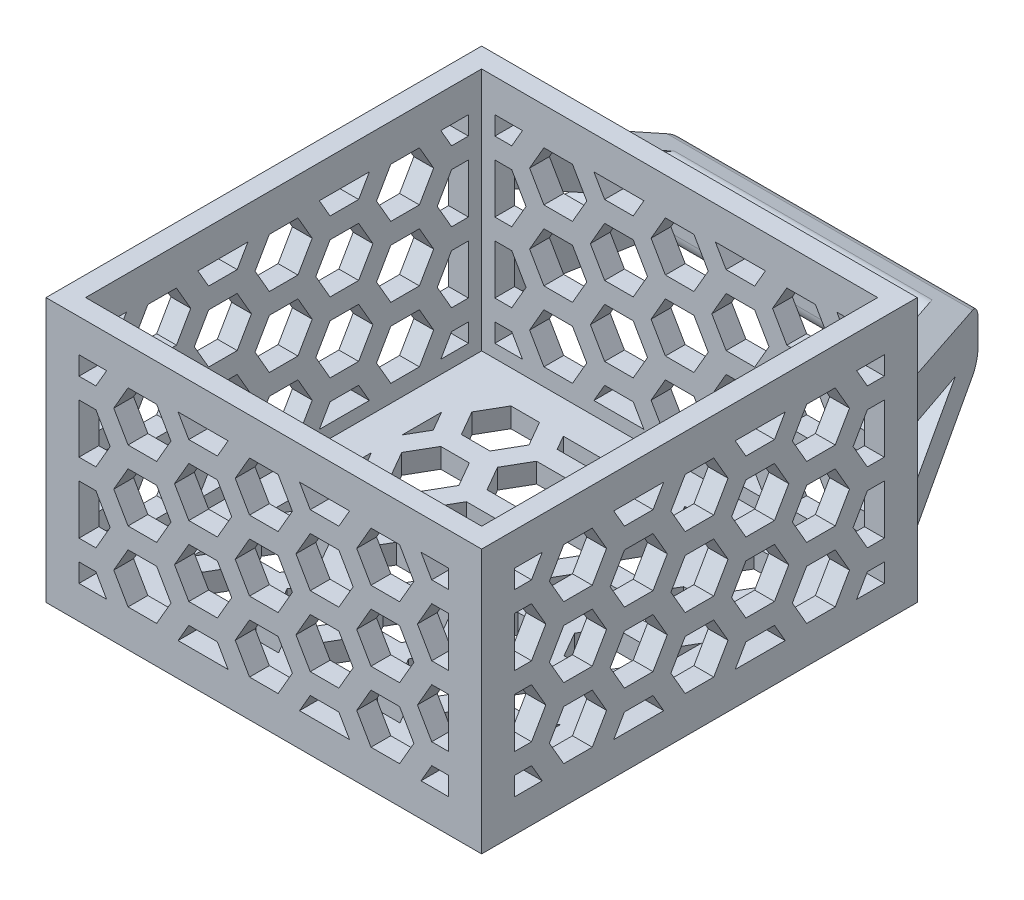
from build123d import *

# Parameters (mm, degrees)
SKETCH1_W               = 120
SKETCH1_H               = 120
BOSS_EXTRUDE2_DEPTH     = 6
SKETCH2_W               = 132
SKETCH2_H               = 80
BOSS_EXTRUDE3_DEPTH     = 6
SKETCH3_W               = 120
SKETCH3_H               = 80
BOSS_EXTRUDE4_DEPTH     = 6
BOSS_EXTRUDE5_START     = -40
BOSS_EXTRUDE5_DEPTH     = 20
CUT_EXTRUDE2_DEPTH      = 149.296999295
CUT_EXTRUDE2_DEPTH_BACK = 149.296999295
FILLET2_R               = 5
FILLET3_R               = 5
FILLET4_R               = 5
FILLET5_R               = 5


with BuildPart() as part:
    # Sketch1 → Boss-Extrude2 (new body)
    with BuildSketch(Plane(origin=(0, 0, 0), x_dir=(1, 0, 0), z_dir=(0, 1, 0))):
        Rectangle(SKETCH1_W, SKETCH1_H)
        Polygon((8.660254038, 21.25), (4.330127019, 28.75), (-4.330127019, 28.75), (-8.660254038, 21.25), (-4.330127019, 13.75), (4.330127019, 13.75), align=None, mode=Mode.SUBTRACT)
        Polygon((8.660254038, 0), (4.330127019, 7.5), (-4.330127019, 7.5), (-8.660254038, 0), (-4.330127019, -7.5), (4.330127019, -7.5), align=None, mode=Mode.SUBTRACT)
        Polygon((8.660254038, 42.5), (4.330127019, 50), (-4.330127019, 50), (-8.660254038, 42.5), (-4.330127019, 35), (4.330127019, 35), align=None, mode=Mode.SUBTRACT)
        Polygon((8.660254038, -21.25), (4.330127019, -13.75), (-4.330127019, -13.75), (-8.660254038, -21.25), (-4.330127019, -28.75), (4.330127019, -28.75), align=None, mode=Mode.SUBTRACT)
        Polygon((8.660254038, -42.5), (4.330127019, -35), (-4.330127019, -35), (-8.660254038, -42.5), (-4.330127019, -50), (4.330127019, -50), align=None, mode=Mode.SUBTRACT)
        Polygon((27.063293868, 31.875), (22.733166849, 39.375), (14.072912811, 39.375), (9.742785793, 31.875), (14.072912811, 24.375), (22.733166849, 24.375), align=None, mode=Mode.SUBTRACT)
        Polygon((27.063293868, 10.625), (22.733166849, 18.125), (14.072912811, 18.125), (9.742785793, 10.625), (14.072912811, 3.125), (22.733166849, 3.125), align=None, mode=Mode.SUBTRACT)
        Polygon((11.547005384, 50), (14.072912811, 45.625), (22.733166849, 45.625), (25.259074277, 50), align=None, mode=Mode.SUBTRACT)
        Polygon((11.547005384, -50), (14.072912811, -45.625), (22.733166849, -45.625), (25.259074277, -50), align=None, mode=Mode.SUBTRACT)
        Polygon((22.733166849, -24.375), (27.063293868, -31.875), (22.733166849, -39.375), (14.072912811, -39.375), (9.742785793, -31.875), (14.072912811, -24.375), align=None, mode=Mode.SUBTRACT)
        Polygon((22.733166849, -3.125), (27.063293868, -10.625), (22.733166849, -18.125), (14.072912811, -18.125), (9.742785793, -10.625), (14.072912811, -3.125), align=None, mode=Mode.SUBTRACT)
        Polygon((45.466333699, 42.5), (41.13620668, 50), (32.475952642, 50), (28.145825623, 42.5), (32.475952642, 35), (41.13620668, 35), align=None, mode=Mode.SUBTRACT)
        Polygon((45.466333699, 21.25), (41.13620668, 28.75), (32.475952642, 28.75), (28.145825623, 21.25), (32.475952642, 13.75), (41.13620668, 13.75), align=None, mode=Mode.SUBTRACT)
        Polygon((45.466333699, 0), (41.13620668, 7.5), (32.475952642, 7.5), (28.145825623, 0), (32.475952642, -7.5), (41.13620668, -7.5), align=None, mode=Mode.SUBTRACT)
        Polygon((45.466333699, -21.25), (41.13620668, -13.75), (32.475952642, -13.75), (28.145825623, -21.25), (32.475952642, -28.75), (41.13620668, -28.75), align=None, mode=Mode.SUBTRACT)
        Polygon((45.466333699, -42.5), (41.13620668, -35), (32.475952642, -35), (28.145825623, -42.5), (32.475952642, -50), (41.13620668, -50), align=None, mode=Mode.SUBTRACT)
        Polygon((50, 37.852540378), (46.548865453, 31.875), (50, 25.897459622), align=None, mode=Mode.SUBTRACT)
        Polygon((50, 16.602540378), (46.548865453, 10.625), (50, 4.647459622), align=None, mode=Mode.SUBTRACT)
        Polygon((50, -16.602540378), (46.548865453, -10.625), (50, -4.647459622), align=None, mode=Mode.SUBTRACT)
        Polygon((50, -37.852540378), (46.548865453, -31.875), (50, -25.897459622), align=None, mode=Mode.SUBTRACT)
        Polygon((-46.548865453, -31.875), (-50, -25.897459622), (-50, -37.852540378), align=None, mode=Mode.SUBTRACT)
        Polygon((-46.548865453, -10.625), (-50, -4.647459622), (-50, -16.602540378), align=None, mode=Mode.SUBTRACT)
        Polygon((-50, 16.602540378), (-46.548865453, 10.625), (-50, 4.647459622), align=None, mode=Mode.SUBTRACT)
        Polygon((-50, 37.852540378), (-46.548865453, 31.875), (-50, 25.897459622), align=None, mode=Mode.SUBTRACT)
        Polygon((-41.13620668, 35), (-45.466333699, 42.5), (-41.13620668, 50), (-32.475952642, 50), (-28.145825623, 42.5), (-32.475952642, 35), align=None, mode=Mode.SUBTRACT)
        Polygon((-41.13620668, 13.75), (-45.466333699, 21.25), (-41.13620668, 28.75), (-32.475952642, 28.75), (-28.145825623, 21.25), (-32.475952642, 13.75), align=None, mode=Mode.SUBTRACT)
        Polygon((-41.13620668, -7.5), (-45.466333699, 0), (-41.13620668, 7.5), (-32.475952642, 7.5), (-28.145825623, 0), (-32.475952642, -7.5), align=None, mode=Mode.SUBTRACT)
        Polygon((-41.13620668, -28.75), (-45.466333699, -21.25), (-41.13620668, -13.75), (-32.475952642, -13.75), (-28.145825623, -21.25), (-32.475952642, -28.75), align=None, mode=Mode.SUBTRACT)
        Polygon((-41.13620668, -50), (-45.466333699, -42.5), (-41.13620668, -35), (-32.475952642, -35), (-28.145825623, -42.5), (-32.475952642, -50), align=None, mode=Mode.SUBTRACT)
        Polygon((-11.547005384, -50), (-25.259074277, -50), (-22.733166849, -45.625), (-14.072912811, -45.625), align=None, mode=Mode.SUBTRACT)
        Polygon((-14.072912811, -24.375), (-22.733166849, -24.375), (-27.063293868, -31.875), (-22.733166849, -39.375), (-14.072912811, -39.375), (-9.742785793, -31.875), align=None, mode=Mode.SUBTRACT)
        Polygon((-14.072912811, -3.125), (-22.733166849, -3.125), (-27.063293868, -10.625), (-22.733166849, -18.125), (-14.072912811, -18.125), (-9.742785793, -10.625), align=None, mode=Mode.SUBTRACT)
        Polygon((-22.733166849, 3.125), (-27.063293868, 10.625), (-22.733166849, 18.125), (-14.072912811, 18.125), (-9.742785793, 10.625), (-14.072912811, 3.125), align=None, mode=Mode.SUBTRACT)
        Polygon((-11.547005384, 50), (-14.072912811, 45.625), (-22.733166849, 45.625), (-25.259074277, 50), align=None, mode=Mode.SUBTRACT)
        Polygon((-22.733166849, 24.375), (-27.063293868, 31.875), (-22.733166849, 39.375), (-14.072912811, 39.375), (-9.742785793, 31.875), (-14.072912811, 24.375), align=None, mode=Mode.SUBTRACT)
    extrude(amount=BOSS_EXTRUDE2_DEPTH)

    # Sketch2 → Boss-Extrude3 (add)
    with BuildSketch(Plane.XY.offset(60)):
        with Locations((0, 40)):
            Rectangle(SKETCH2_W, SKETCH2_H)
        Polygon((8.660254038, 61.25), (4.330127019, 68.75), (-4.330127019, 68.75), (-8.660254038, 61.25), (-4.330127019, 53.75), (4.330127019, 53.75), align=None, mode=Mode.SUBTRACT)
        Polygon((8.660254038, 40), (4.330127019, 47.5), (-4.330127019, 47.5), (-8.660254038, 40), (-4.330127019, 32.5), (4.330127019, 32.5), align=None, mode=Mode.SUBTRACT)
        Polygon((4.330127019, 26.25), (8.660254038, 18.75), (4.330127019, 11.25), (-4.330127019, 11.25), (-8.660254038, 18.75), (-4.330127019, 26.25), align=None, mode=Mode.SUBTRACT)
        Polygon((27.063293868, 50.625), (22.733166849, 58.125), (14.072912811, 58.125), (9.742785793, 50.625), (14.072912811, 43.125), (22.733166849, 43.125), align=None, mode=Mode.SUBTRACT)
        Polygon((10.825317547, 70), (14.072912811, 64.375), (22.733166849, 64.375), (25.980762114, 70), align=None, mode=Mode.SUBTRACT)
        Polygon((22.733166849, 36.875), (27.063293868, 29.375), (22.733166849, 21.875), (14.072912811, 21.875), (9.742785793, 29.375), (14.072912811, 36.875), align=None, mode=Mode.SUBTRACT)
        Polygon((10.825317547, 10), (14.072912811, 15.625), (22.733166849, 15.625), (25.980762114, 10), align=None, mode=Mode.SUBTRACT)
        Polygon((45.466333699, 61.25), (41.13620668, 68.75), (32.475952642, 68.75), (28.145825623, 61.25), (32.475952642, 53.75), (41.13620668, 53.75), align=None, mode=Mode.SUBTRACT)
        Polygon((45.466333699, 40), (41.13620668, 47.5), (32.475952642, 47.5), (28.145825623, 40), (32.475952642, 32.5), (41.13620668, 32.5), align=None, mode=Mode.SUBTRACT)
        Polygon((41.13620668, 26.25), (45.466333699, 18.75), (41.13620668, 11.25), (32.475952642, 11.25), (28.145825623, 18.75), (32.475952642, 26.25), align=None, mode=Mode.SUBTRACT)
        Polygon((47.631397208, 70), (56, 70), (56, 64.375), (50.878992472, 64.375), align=None, mode=Mode.SUBTRACT)
        Polygon((56, 58.125), (50.878992472, 58.125), (46.548865453, 50.625), (50.878992472, 43.125), (56, 43.125), align=None, mode=Mode.SUBTRACT)
        Polygon((56, 21.875), (50.878992472, 21.875), (46.548865453, 29.375), (50.878992472, 36.875), (56, 36.875), align=None, mode=Mode.SUBTRACT)
        Polygon((47.631397208, 10), (50.878992472, 15.625), (56, 15.625), (56, 10), align=None, mode=Mode.SUBTRACT)
        Polygon((-50.878992472, 15.625), (-56, 15.625), (-56, 10), (-47.631397208, 10), align=None, mode=Mode.SUBTRACT)
        Polygon((-50.878992472, 36.875), (-56, 36.875), (-56, 21.875), (-50.878992472, 21.875), (-46.548865453, 29.375), align=None, mode=Mode.SUBTRACT)
        Polygon((-56, 58.125), (-50.878992472, 58.125), (-46.548865453, 50.625), (-50.878992472, 43.125), (-56, 43.125), align=None, mode=Mode.SUBTRACT)
        Polygon((-47.631397208, 70), (-56, 70), (-56, 64.375), (-50.878992472, 64.375), align=None, mode=Mode.SUBTRACT)
        Polygon((-41.13620668, 53.75), (-45.466333699, 61.25), (-41.13620668, 68.75), (-32.475952642, 68.75), (-28.145825623, 61.25), (-32.475952642, 53.75), align=None, mode=Mode.SUBTRACT)
        Polygon((-41.13620668, 32.5), (-45.466333699, 40), (-41.13620668, 47.5), (-32.475952642, 47.5), (-28.145825623, 40), (-32.475952642, 32.5), align=None, mode=Mode.SUBTRACT)
        Polygon((-32.475952642, 26.25), (-41.13620668, 26.25), (-45.466333699, 18.75), (-41.13620668, 11.25), (-32.475952642, 11.25), (-28.145825623, 18.75), align=None, mode=Mode.SUBTRACT)
        Polygon((-10.825317547, 10), (-25.980762114, 10), (-22.733166849, 15.625), (-14.072912811, 15.625), align=None, mode=Mode.SUBTRACT)
        Polygon((-14.072912811, 36.875), (-22.733166849, 36.875), (-27.063293868, 29.375), (-22.733166849, 21.875), (-14.072912811, 21.875), (-9.742785793, 29.375), align=None, mode=Mode.SUBTRACT)
        Polygon((-22.733166849, 43.125), (-27.063293868, 50.625), (-22.733166849, 58.125), (-14.072912811, 58.125), (-9.742785793, 50.625), (-14.072912811, 43.125), align=None, mode=Mode.SUBTRACT)
        Polygon((-10.825317547, 70), (-14.072912811, 64.375), (-22.733166849, 64.375), (-25.980762114, 70), align=None, mode=Mode.SUBTRACT)
    boss_extrude3 = extrude(amount=BOSS_EXTRUDE3_DEPTH)

    # Mirror1: Boss-Extrude3 across plane
    add(boss_extrude3.mirror(Plane.XY))

    # Sketch3 → Boss-Extrude4 (add)
    with BuildSketch(Plane.ZY.offset(60)):
        with Locations((0, 40)):
            Rectangle(SKETCH3_W, SKETCH3_H)
        Polygon((8.660254038, 40), (4.330127019, 47.5), (-4.330127019, 47.5), (-8.660254038, 40), (-4.330127019, 32.5), (4.330127019, 32.5), align=None, mode=Mode.SUBTRACT)
        Polygon((8.660254038, 61.25), (4.330127019, 68.75), (-4.330127019, 68.75), (-8.660254038, 61.25), (-4.330127019, 53.75), (4.330127019, 53.75), align=None, mode=Mode.SUBTRACT)
        Polygon((4.330127019, 26.25), (8.660254038, 18.75), (4.330127019, 11.25), (-4.330127019, 11.25), (-8.660254038, 18.75), (-4.330127019, 26.25), align=None, mode=Mode.SUBTRACT)
        Polygon((27.063293868, 50.625), (22.733166849, 58.125), (14.072912811, 58.125), (9.742785793, 50.625), (14.072912811, 43.125), (22.733166849, 43.125), align=None, mode=Mode.SUBTRACT)
        Polygon((10.825317547, 70), (14.072912811, 64.375), (22.733166849, 64.375), (25.980762114, 70), align=None, mode=Mode.SUBTRACT)
        Polygon((22.733166849, 36.875), (27.063293868, 29.375), (22.733166849, 21.875), (14.072912811, 21.875), (9.742785793, 29.375), (14.072912811, 36.875), align=None, mode=Mode.SUBTRACT)
        Polygon((10.825317547, 10), (14.072912811, 15.625), (22.733166849, 15.625), (25.980762114, 10), align=None, mode=Mode.SUBTRACT)
        Polygon((45.466333699, 61.25), (41.13620668, 68.75), (32.475952642, 68.75), (28.145825623, 61.25), (32.475952642, 53.75), (41.13620668, 53.75), align=None, mode=Mode.SUBTRACT)
        Polygon((45.466333699, 40), (41.13620668, 47.5), (32.475952642, 47.5), (28.145825623, 40), (32.475952642, 32.5), (41.13620668, 32.5), align=None, mode=Mode.SUBTRACT)
        Polygon((41.13620668, 26.25), (45.466333699, 18.75), (41.13620668, 11.25), (32.475952642, 11.25), (28.145825623, 18.75), (32.475952642, 26.25), align=None, mode=Mode.SUBTRACT)
        Polygon((47.631397208, 70), (56, 70), (56, 64.375), (50.878992472, 64.375), align=None, mode=Mode.SUBTRACT)
        Polygon((56, 58.125), (50.878992472, 58.125), (46.548865453, 50.625), (50.878992472, 43.125), (56, 43.125), align=None, mode=Mode.SUBTRACT)
        Polygon((56, 21.875), (50.878992472, 21.875), (46.548865453, 29.375), (50.878992472, 36.875), (56, 36.875), align=None, mode=Mode.SUBTRACT)
        Polygon((47.631397208, 10), (50.878992472, 15.625), (56, 15.625), (56, 10), align=None, mode=Mode.SUBTRACT)
        Polygon((-50.878992472, 15.625), (-56, 15.625), (-56, 10), (-47.631397208, 10), align=None, mode=Mode.SUBTRACT)
        Polygon((-50.878992472, 36.875), (-56, 36.875), (-56, 21.875), (-50.878992472, 21.875), (-46.548865453, 29.375), align=None, mode=Mode.SUBTRACT)
        Polygon((-56, 58.125), (-50.878992472, 58.125), (-46.548865453, 50.625), (-50.878992472, 43.125), (-56, 43.125), align=None, mode=Mode.SUBTRACT)
        Polygon((-47.631397208, 70), (-56, 70), (-56, 64.375), (-50.878992472, 64.375), align=None, mode=Mode.SUBTRACT)
        Polygon((-41.13620668, 53.75), (-45.466333699, 61.25), (-41.13620668, 68.75), (-32.475952642, 68.75), (-28.145825623, 61.25), (-32.475952642, 53.75), align=None, mode=Mode.SUBTRACT)
        Polygon((-41.13620668, 32.5), (-45.466333699, 40), (-41.13620668, 47.5), (-32.475952642, 47.5), (-28.145825623, 40), (-32.475952642, 32.5), align=None, mode=Mode.SUBTRACT)
        Polygon((-32.475952642, 26.25), (-41.13620668, 26.25), (-45.466333699, 18.75), (-41.13620668, 11.25), (-32.475952642, 11.25), (-28.145825623, 18.75), align=None, mode=Mode.SUBTRACT)
        Polygon((-10.825317547, 10), (-25.980762114, 10), (-22.733166849, 15.625), (-14.072912811, 15.625), align=None, mode=Mode.SUBTRACT)
        Polygon((-14.072912811, 36.875), (-22.733166849, 36.875), (-27.063293868, 29.375), (-22.733166849, 21.875), (-14.072912811, 21.875), (-9.742785793, 29.375), align=None, mode=Mode.SUBTRACT)
        Polygon((-22.733166849, 43.125), (-27.063293868, 50.625), (-22.733166849, 58.125), (-14.072912811, 58.125), (-9.742785793, 50.625), (-14.072912811, 43.125), align=None, mode=Mode.SUBTRACT)
        Polygon((-10.825317547, 70), (-14.072912811, 64.375), (-22.733166849, 64.375), (-25.980762114, 70), align=None, mode=Mode.SUBTRACT)
    boss_extrude4 = extrude(amount=BOSS_EXTRUDE4_DEPTH)

    # Mirror2: Boss-Extrude4 across plane
    add(boss_extrude4.mirror(Plane(origin=(0, 0, 0), x_dir=(0, 0, 1), z_dir=(1, 0, 0))))

    # Sketch4 → Boss-Extrude5 (add, symmetric)
    with BuildSketch(Plane.XZ.offset(BOSS_EXTRUDE5_START)):
        Polygon((-66, -66), (-44.4, -106), (44.4, -106), (66, -66), (56, -66), (42.5, -91), (-42.5, -91), (-56, -66), align=None)
    extrude(amount=BOSS_EXTRUDE5_DEPTH, both=True)

    # Sketch5 → Cut-Extrude2 (cut, two sides: drawn at the far end of the back side and taken through both)
    with BuildSketch(Plane(origin=(0, 0, 0), x_dir=(0, 0, -1), z_dir=(1, 0, 0)).offset(-CUT_EXTRUDE2_DEPTH_BACK)):
        Polygon((106, 60), (66, 60), (106, 47.5), align=None)
        Polygon((106, 32.5), (66, 20), (106, 20), align=None)
        Polygon((91, 40), (66, 47.5), (66, 32.5), align=None)
    extrude(amount=CUT_EXTRUDE2_DEPTH + CUT_EXTRUDE2_DEPTH_BACK, mode=Mode.SUBTRACT)

    # Fillet2
    fillet2_edges = [part.edges().sort_by_distance(p)[0] for p in [
        (0, 47.5, -106),
    ]]
    fillet(fillet2_edges, radius=FILLET2_R)

    # Fillet3
    fillet3_edges = [part.edges().sort_by_distance(p)[0] for p in [
        (0, 32.5, -106),
    ]]
    fillet(fillet3_edges, radius=FILLET3_R)

    # Fillet4
    fillet4_edges = [part.edges().sort_by_distance(p)[0] for p in [
        (0, 52.1875, -91),
    ]]
    fillet(fillet4_edges, radius=FILLET4_R)

    # Fillet5
    fillet5_edges = [part.edges().sort_by_distance(p)[0] for p in [
        (0, 27.8125, -91),
    ]]
    fillet(fillet5_edges, radius=FILLET5_R)


solid = part.part
